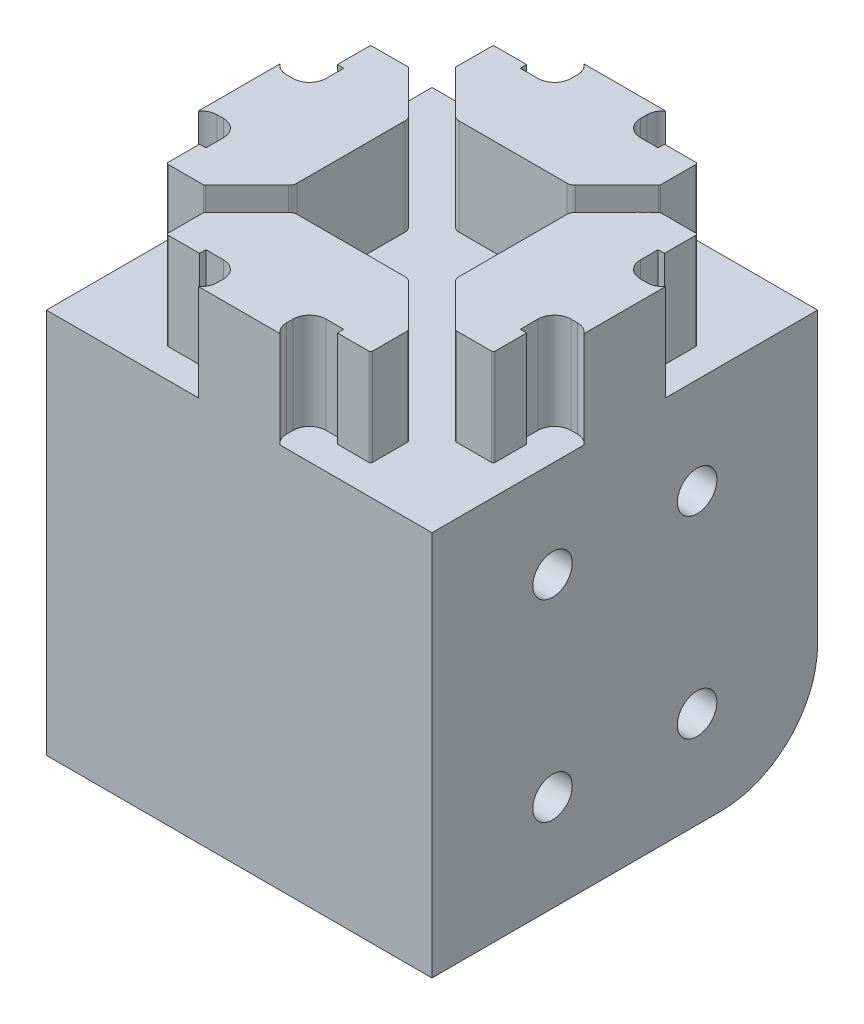
from build123d import *

# Parameters (mm, degrees)
SKETCH1_W           = 40
SKETCH1_H           = 40
BOSS_EXTRUDE1_DEPTH = 20
CUT_EXTRUDE1_START  = 13
SKETCH2_R           = 2.05
CUT_EXTRUDE1_DEPTH  = 48.641016151
BOSS_EXTRUDE2_DEPTH = 10
FILLET1_R           = 10


with BuildPart() as part:
    # Sketch1 → Boss-Extrude1 (new, symmetric)
    with BuildSketch(Plane(origin=(0, 0, 0), x_dir=(1, 0, 0), z_dir=(0, 1, 0))):
        Rectangle(SKETCH1_W, SKETCH1_H)
    extrude(amount=BOSS_EXTRUDE1_DEPTH, both=True)

    # Sketch2 → Cut-Extrude1 (cut, through all)
    with BuildSketch(Plane(origin=(0, 0, 0), x_dir=(0, 0, -1), z_dir=(1, 0, 0)).offset(CUT_EXTRUDE1_START)):
        with Locations((-7.5, 10)):
            Circle(SKETCH2_R)
        with Locations((7.5, 10)):
            Circle(SKETCH2_R)
        with Locations((-7.5, -10)):
            Circle(SKETCH2_R)
        with Locations((7.5, -10)):
            Circle(SKETCH2_R)
    cut_extrude1 = extrude(amount=-CUT_EXTRUDE1_DEPTH, mode=Mode.SUBTRACT)

    # Mirror1: Cut-Extrude1 across plane
    add(cut_extrude1.mirror(Plane(origin=(0, 0, 0), x_dir=(0, 0, 1), z_dir=(1, 0, 0))), mode=Mode.SUBTRACT)

    # Sketch3 → Boss-Extrude2 (add)
    with BuildSketch(Plane(origin=(0, 20, 0), x_dir=(1, 0, 0), z_dir=(0, 1, 0))):
        with BuildLine():
            Line((11.826654762, 9.48989286), (11.826654762, 9.394207435))
            Line((11.826654762, 9.394207435), (8.669461761, 6.237014434))
            ThreePointArc((8.669461761, 6.237014434), (8.47003083, 5.938544953), (8.4, 5.586476195))
            Line((8.4, 5.586476195), (8.4, -5.586476195))
            ThreePointArc((8.4, -5.586476195), (8.47003083, -5.938544953), (8.669461761, -6.237014434))
            Line((8.669461761, -6.237014434), (12.973868684, -10.541421356))
            ThreePointArc((12.973868684, -10.541421356), (13.038753353, -10.584775907), (13.11529004, -10.6))
            Line((13.11529004, -10.6), (16.76, -10.6))
            ThreePointArc((16.76, -10.6), (16.901421356, -10.541421356), (16.96, -10.4))
            Line((16.96, -10.4), (16.96, -7.15))
            Line((16.96, -7.15), (16.3, -7.15))
            Line((16.3, -7.15), (16.3, -5.32))
            ThreePointArc((16.3, -5.32), (16.803776336, -4.103776336), (18.02, -3.6))
            Line((18.02, -3.6), (18.68, -3.6))
            ThreePointArc((18.68, -3.6), (19.408599647, -3.761942699), (20, -4.2172761))
            Line((20, -4.2172761), (20, 4.2172761))
            ThreePointArc((20, 4.2172761), (19.408599647, 3.761942699), (18.68, 3.6))
            Line((18.68, 3.6), (18.02, 3.6))
            ThreePointArc((18.02, 3.6), (16.803776336, 4.103776336), (16.3, 5.32))
            Line((16.3, 5.32), (16.3, 7.15))
            Line((16.3, 7.15), (16.96, 7.15))
            Line((16.96, 7.15), (16.96, 10.4))
            ThreePointArc((16.96, 10.4), (16.901421356, 10.541421356), (16.76, 10.6))
            Line((16.76, 10.6), (13.11529004, 10.6))
            ThreePointArc((13.11529004, 10.6), (13.038753353, 10.584775907), (12.973868684, 10.541421356))
            Line((12.973868684, 10.541421356), (12.485685425, 10.053238098))
            Line((12.485685425, 10.053238098), (12.39, 10.053238098))
            Line((12.39, 10.053238098), (12.39, 9.957552673))
            Line((12.39, 9.957552673), (11.922340187, 9.48989286))
            Line((11.922340187, 9.48989286), (11.826654762, 9.48989286))
        make_face()
        with BuildLine():
            Line((-4.2172761, -20), (4.2172761, -20))
            ThreePointArc((4.2172761, -20), (3.761942699, -19.408599647), (3.6, -18.68))
            Line((3.6, -18.68), (3.6, -18.02))
            ThreePointArc((3.6, -18.02), (4.103776336, -16.803776336), (5.32, -16.3))
            Line((5.32, -16.3), (7.15, -16.3))
            Line((7.15, -16.3), (7.15, -16.96))
            Line((7.15, -16.96), (10.4, -16.96))
            ThreePointArc((10.4, -16.96), (10.541421356, -16.901421356), (10.6, -16.76))
            Line((10.6, -16.76), (10.6, -13.11529004))
            ThreePointArc((10.6, -13.11529004), (10.584775907, -13.038753353), (10.541421356, -12.973868684))
            Line((10.541421356, -12.973868684), (6.237014434, -8.669461761))
            ThreePointArc((6.237014434, -8.669461761), (5.938544953, -8.47003083), (5.586476195, -8.4))
            Line((5.586476195, -8.4), (-5.586476195, -8.4))
            ThreePointArc((-5.586476195, -8.4), (-5.938544953, -8.47003083), (-6.237014434, -8.669461761))
            Line((-6.237014434, -8.669461761), (-10.541421356, -12.973868684))
            ThreePointArc((-10.541421356, -12.973868684), (-10.584775907, -13.038753353), (-10.6, -13.11529004))
            Line((-10.6, -13.11529004), (-10.6, -16.76))
            ThreePointArc((-10.6, -16.76), (-10.541421356, -16.901421356), (-10.4, -16.96))
            Line((-10.4, -16.96), (-7.15, -16.96))
            Line((-7.15, -16.96), (-7.15, -16.3))
            Line((-7.15, -16.3), (-5.32, -16.3))
            ThreePointArc((-5.32, -16.3), (-4.103776336, -16.803776336), (-3.6, -18.02))
            Line((-3.6, -18.02), (-3.6, -18.68))
            ThreePointArc((-3.6, -18.68), (-3.761942699, -19.408599647), (-4.2172761, -20))
        make_face()
        with BuildLine():
            ThreePointArc((3.6, 18.68), (3.761942699, 19.408599647), (4.2172761, 20))
            Line((4.2172761, 20), (-4.2172761, 20))
            ThreePointArc((-4.2172761, 20), (-3.761942699, 19.408599647), (-3.6, 18.68))
            Line((-3.6, 18.68), (-3.6, 18.02))
            ThreePointArc((-3.6, 18.02), (-4.103776336, 16.803776336), (-5.32, 16.3))
            Line((-5.32, 16.3), (-7.15, 16.3))
            Line((-7.15, 16.3), (-7.15, 16.96))
            Line((-7.15, 16.96), (-10.4, 16.96))
            ThreePointArc((-10.4, 16.96), (-10.541421356, 16.901421356), (-10.6, 16.76))
            Line((-10.6, 16.76), (-10.6, 13.11529004))
            ThreePointArc((-10.6, 13.11529004), (-10.584775907, 13.038753353), (-10.541421356, 12.973868684))
            Line((-10.541421356, 12.973868684), (-6.237014434, 8.669461761))
            ThreePointArc((-6.237014434, 8.669461761), (-5.938544953, 8.47003083), (-5.586476195, 8.4))
            Line((-5.586476195, 8.4), (5.586476195, 8.4))
            ThreePointArc((5.586476195, 8.4), (5.938544953, 8.47003083), (6.237014434, 8.669461761))
            Line((6.237014434, 8.669461761), (10.541421356, 12.973868684))
            ThreePointArc((10.541421356, 12.973868684), (10.584775907, 13.038753353), (10.6, 13.11529004))
            Line((10.6, 13.11529004), (10.6, 16.76))
            ThreePointArc((10.6, 16.76), (10.541421356, 16.901421356), (10.4, 16.96))
            Line((10.4, 16.96), (7.15, 16.96))
            Line((7.15, 16.96), (7.15, 16.3))
            Line((7.15, 16.3), (5.32, 16.3))
            ThreePointArc((5.32, 16.3), (4.103776336, 16.803776336), (3.6, 18.02))
            Line((3.6, 18.02), (3.6, 18.68))
        make_face()
        with BuildLine():
            Line((-20, 4.2172761), (-20, -4.2172761))
            ThreePointArc((-20, -4.2172761), (-19.408599647, -3.761942699), (-18.68, -3.6))
            Line((-18.68, -3.6), (-18.02, -3.6))
            ThreePointArc((-18.02, -3.6), (-16.803776336, -4.103776336), (-16.3, -5.32))
            Line((-16.3, -5.32), (-16.3, -7.15))
            Line((-16.3, -7.15), (-16.96, -7.15))
            Line((-16.96, -7.15), (-16.96, -10.4))
            ThreePointArc((-16.96, -10.4), (-16.901421356, -10.541421356), (-16.76, -10.6))
            Line((-16.76, -10.6), (-13.11529004, -10.6))
            ThreePointArc((-13.11529004, -10.6), (-13.038753353, -10.584775907), (-12.973868684, -10.541421356))
            Line((-12.973868684, -10.541421356), (-8.669461761, -6.237014434))
            ThreePointArc((-8.669461761, -6.237014434), (-8.47003083, -5.938544953), (-8.4, -5.586476195))
            Line((-8.4, -5.586476195), (-8.4, 5.586476195))
            ThreePointArc((-8.4, 5.586476195), (-8.47003083, 5.938544953), (-8.669461761, 6.237014434))
            Line((-8.669461761, 6.237014434), (-12.973868684, 10.541421356))
            ThreePointArc((-12.973868684, 10.541421356), (-13.038753353, 10.584775907), (-13.11529004, 10.6))
            Line((-13.11529004, 10.6), (-16.76, 10.6))
            ThreePointArc((-16.76, 10.6), (-16.901421356, 10.541421356), (-16.96, 10.4))
            Line((-16.96, 10.4), (-16.96, 7.15))
            Line((-16.96, 7.15), (-16.3, 7.15))
            Line((-16.3, 7.15), (-16.3, 5.32))
            ThreePointArc((-16.3, 5.32), (-16.803776336, 4.103776336), (-18.02, 3.6))
            Line((-18.02, 3.6), (-18.68, 3.6))
            ThreePointArc((-18.68, 3.6), (-19.408599647, 3.761942699), (-20, 4.2172761))
        make_face()
    extrude(amount=BOSS_EXTRUDE2_DEPTH)

    # Fillet1
    fillet1_edges = [part.edges().sort_by_distance(p)[0] for p in [
        (0, -20, -20),
    ]]
    fillet(fillet1_edges, radius=FILLET1_R)


solid = part.part
